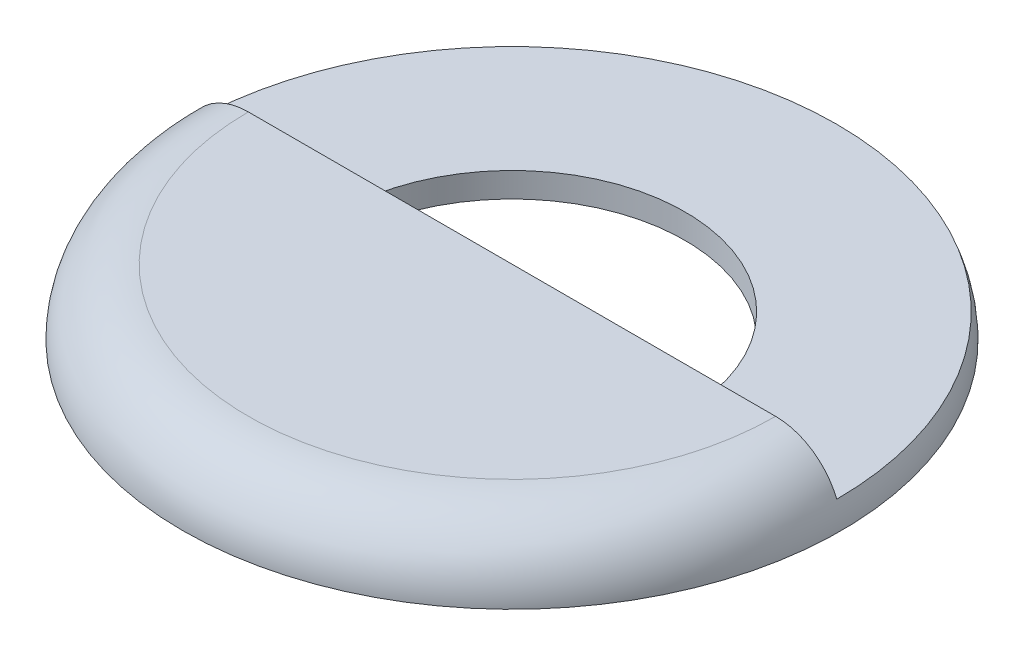
from build123d import *

# Parameters (mm, degrees)
CUT_EXTRUDE3_DEPTH           = 60
CUT_EXTRUDE5_DEPTH           = 2
CUT_EXTRUDE5_DEPTH_BACK      = 30
SKETCH19_W                   = 12
SKETCH19_H                   = 36.5
CUT_REVOLVE2_ANGLE           = 65
CUT_REVOLVE2_OTHER_WAY_ANGLE = 65
SKETCH21_W                   = 3.25
SKETCH21_H                   = 4
BOSS_EXTRUDE3_DEPTH          = 1.35
CIRPATTERN1_COUNT            = 5
CUT_EXTRUDE9_START           = -5
CUT_EXTRUDE9_DEPTH           = 5
INTERSECT1_DEPTH             = 55.427876097
INTERSECT1_START             = 55.427876097
INTERSECT1_2_OUTLINE_R       = 37.002145429
INTERSECT1_2_DEPTH           = 2


# Read off the part's stored shape, not the designer's step: Cut-Extrude9, Intersect1
with BuildPart() as part:
    # Sketch1 → Revolve1 (revolve)
    with BuildSketch(Plane.XY, mode=Mode.PRIVATE) as revolve1_sk:
        with BuildLine():
            Line((0, 63.427876097), (32, 63.427876097))
            ThreePointArc((32, 63.427876097), (37.656854249, 61.084730346), (40, 55.427876097))
            Line((40, 55.427876097), (40, 31.556288966))
            ThreePointArc((40, 31.556288966), (38.188122658, 24.409721904), (33.190210564, 18.989648567))
            Line((33.190210564, 18.989648567), (28.539859624, 15.958818353))
            ThreePointArc((28.539859624, 15.958818353), (25.207918228, 12.345436129), (24, 7.581058088))
            Line((24, 7.581058088), (24, 3.25))
            Line((24, 3.25), (24.35, 3))
            Line((24.35, 3), (24.35, 0))
            Line((24.35, 0), (22.5, 0))
            Line((22.5, 0), (22.5, 12.5))
            ThreePointArc((22.5, 12.5), (22.353553391, 12.853553391), (22, 13))
            Line((22, 13), (0, 13))
            Line((0, 13), (0, 63.427876097))
        make_face()
    revolve(revolve1_sk.sketch.rotate(Axis((0, 0, 0), (0, 1, 0)), 90), axis=Axis((0, 0, 0), (0, 1, 0)))

    # Sketch11 → Cut-Extrude3 (cut)
    with BuildSketch(Plane(origin=(0, 13, 0), x_dir=(-1, 0, 0), z_dir=(0, -1, 0))):
        with BuildLine():
            Line((-21, 0), (21, 0))
            ThreePointArc((21, 0), (0, 21), (-21, 0))
        make_face()
    extrude(amount=-CUT_EXTRUDE3_DEPTH, mode=Mode.SUBTRACT)

    # Sketch9 → Cut-Extrude5 (cut, two sides: drawn at the far end of the back side and taken through both)
    with BuildSketch(Plane(origin=(0, 55.427876097, 0), x_dir=(1, 0, 0), z_dir=(0, 1, 0)).offset(-CUT_EXTRUDE5_DEPTH_BACK)):
        with BuildLine():
            ThreePointArc((-37, -1.601545046), (-0.398454954, -39), (37, -2.398454954))
            ThreePointArc((37, -2.398454954), (0.398454954, 35), (-37, -1.601545046))
        make_face()
        with BuildLine():
            Line((-24, -1.763080838), (24, -1.763080838))
            ThreePointArc((24, -1.763080838), (0, 24), (-24, -1.763080838))
        make_face(mode=Mode.SUBTRACT)
    extrude(amount=CUT_EXTRUDE5_DEPTH + CUT_EXTRUDE5_DEPTH_BACK, mode=Mode.SUBTRACT)

    # Sketch19 → Cut-Revolve2 (revolve, cut)
    with BuildSketch(Plane(origin=(0, 0, 0), x_dir=(0, 0, -1), z_dir=(1, 0, 0))):
        with Locations((-41.064715832, 37.177876097)):
            Rectangle(SKETCH19_W, SKETCH19_H)
    revolve(axis=Axis((0, 0, 0), (0, 1, 0)), revolution_arc=CUT_REVOLVE2_ANGLE, mode=Mode.SUBTRACT)

    # Sketch19 → Cut-Revolve2 other way (revolve, cut)
    with BuildSketch(Plane(origin=(0, 0, 0), x_dir=(0, 0, -1), z_dir=(1, 0, 0))):
        with Locations((-41.064715832, 37.177876097)):
            Rectangle(SKETCH19_W, SKETCH19_H)
    revolve(axis=Axis((0, 0, 0), (0, -1, 0)), revolution_arc=CUT_REVOLVE2_OTHER_WAY_ANGLE, mode=Mode.SUBTRACT)

    # Sketch21 → Boss-Extrude3 (add)
    with BuildSketch(Plane(origin=(0, 0, 22.5), x_dir=(-1, 0, 0), z_dir=(0, 0, -1))):
        with Locations((0, 2)):
            Rectangle(SKETCH21_W, SKETCH21_H)
    boss_extrude3 = extrude(amount=BOSS_EXTRUDE3_DEPTH)

    # CirPattern1: Boss-Extrude3 ×5 about axis
    cirpattern1_axis = Axis((0, 0, 0), (0, 1, 0))
    for i in range(1, CIRPATTERN1_COUNT):
        add(boss_extrude3.rotate(cirpattern1_axis, i * 360 / CIRPATTERN1_COUNT))

    # Cut-Extrude9 outline → Cut-Extrude9 (cut)
    with BuildSketch(Plane(origin=(0, 63.427876097, 0), x_dir=(1, 0, 0), z_dir=(0, 1, 0)).offset(CUT_EXTRUDE9_START)):
        with BuildLine():
            ThreePointArc((40, 0), (0, 40), (-40, 0))
            Line((-40, 0), (-21, 0))
            ThreePointArc((-21, 0), (0, 21), (21, 0))
            Line((21, 0), (40, 0))
        make_face()
    extrude(amount=CUT_EXTRUDE9_DEPTH, mode=Mode.SUBTRACT)

    # Intersect1 outline → Intersect1 (cut)
    with BuildSketch(Plane(origin=(0, 0, 0), x_dir=(1, 0, 0), z_dir=(0, 1, 0))):
        with BuildLine():
            Line((31.779425009, -14.818989253), (36.252311481, -16.90473047))
            ThreePointArc((36.252311481, -16.90473047), (0, 40), (-36.252311481, -16.90473047))
            Line((-36.252311481, -16.90473047), (-31.779425009, -14.818989253))
            ThreePointArc((-31.779425009, -14.818989253), (0, -35.064715832), (31.779425009, -14.818989253))
        make_face()
        with BuildLine():
            ThreePointArc((-21, 0), (0, 21), (21, 0))
            Line((21, 0), (-21, 0))
        make_face(mode=Mode.SUBTRACT)
    extrude(amount=INTERSECT1_DEPTH, mode=Mode.SUBTRACT)

    # Intersect1 2 outline → Intersect1 2 (add)
    with BuildSketch(Plane(origin=(0, 0, 0), x_dir=(1, 0, 0), z_dir=(0, 1, 0)).offset(INTERSECT1_START)):
        with Locations((0, -2)):
            Circle(INTERSECT1_2_OUTLINE_R)
        with BuildLine():
            ThreePointArc((-24, -1.763080838), (0, 24), (24, -1.763080838))
            Line((24, -1.763080838), (-24, -1.763080838))
        make_face(mode=Mode.SUBTRACT)
    extrude(amount=INTERSECT1_2_DEPTH)


solid = part.part
